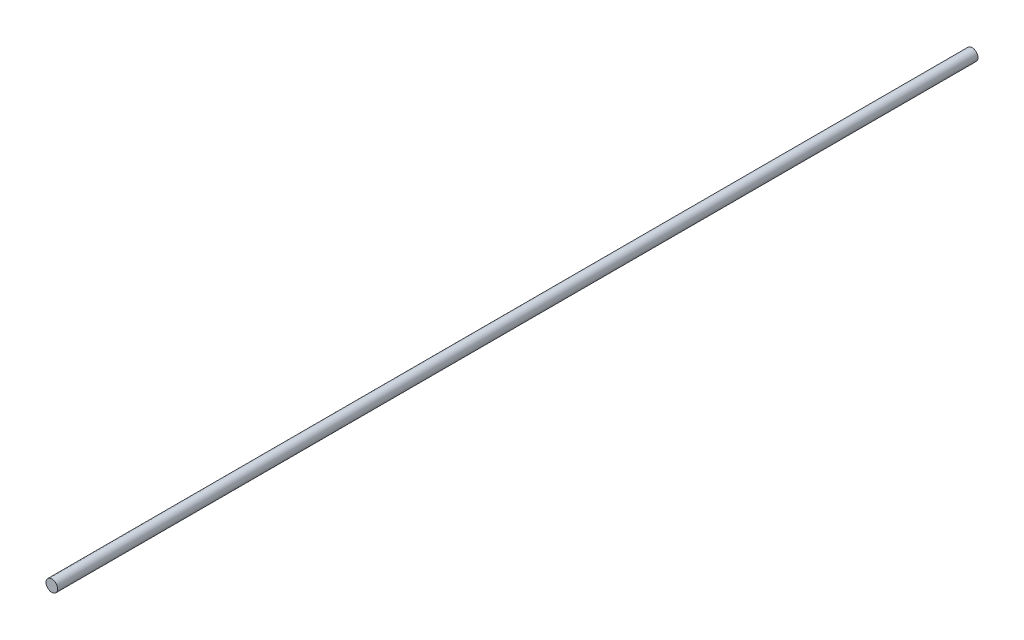
from build123d import *

# Parameters (mm, degrees)
SKETCH1_R           = 3.175
BOSS_EXTRUDE1_DEPTH = 501.65


with BuildPart() as part:
    # Sketch1 → Boss-Extrude1 (new body)
    with BuildSketch(Plane.XY):
        Circle(SKETCH1_R)
    extrude(amount=BOSS_EXTRUDE1_DEPTH)


solid = part.part
